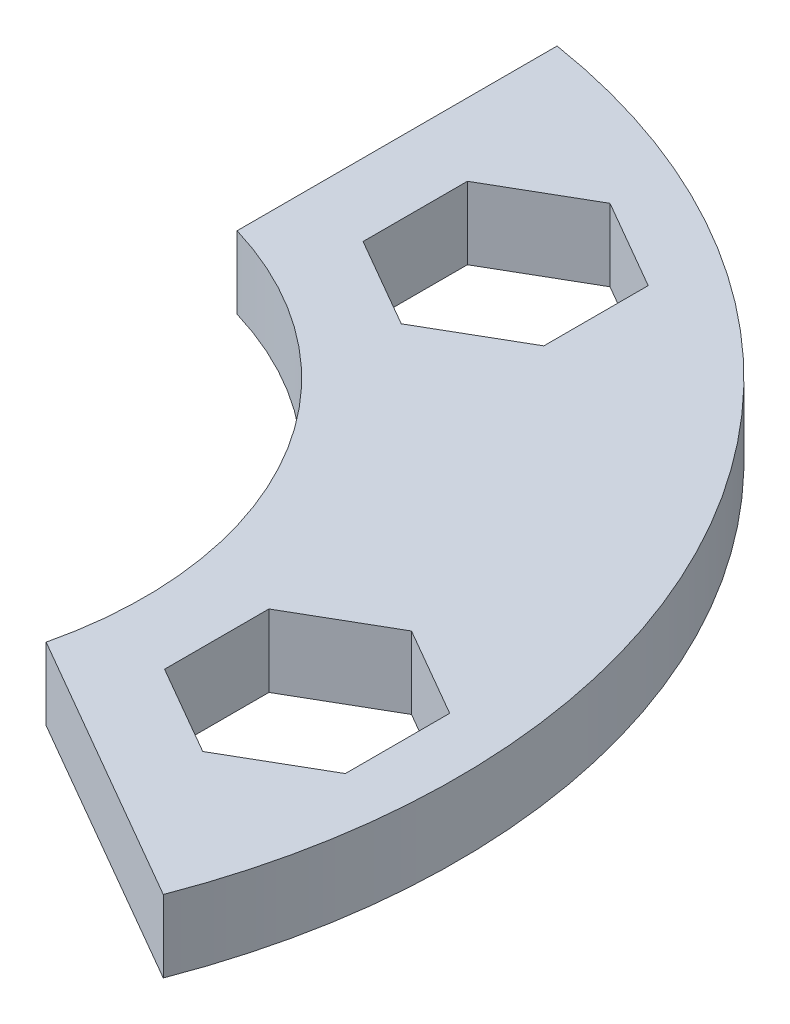
from build123d import *

# Parameters (mm, degrees)
SKETCH1_R           = 38.3
SKETCH1_R_2         = 21
BOSS_EXTRUDE1_DEPTH = 4
CUT_EXTRUDE1_DEPTH  = 10


with BuildPart() as part:
    # Sketch1 → Boss-Extrude1 (new body)
    with BuildSketch(Plane(origin=(0, 0, 0), x_dir=(1, 0, 0), z_dir=(0, 1, 0))):
        Circle(SKETCH1_R)
        Circle(SKETCH1_R_2, mode=Mode.SUBTRACT)
        Polygon((10, -28.867513459), (15, -31.754264805), (20, -28.867513459), (20, -23.094010768), (15, -20.207259422), (10, -23.094010768), align=None, mode=Mode.SUBTRACT)
        Polygon((30, 5.773502692), (25, 2.886751346), (25, -2.886751346), (30, -5.773502692), (35, -2.886751346), (35, 2.886751346), align=None, mode=Mode.SUBTRACT)
        Polygon((-20, -23.094010768), (-20, -28.867513459), (-15, -31.754264805), (-10, -28.867513459), (-10, -23.094010768), (-15, -20.207259422), align=None, mode=Mode.SUBTRACT)
        Polygon((-30, 5.773502692), (-35, 2.886751346), (-35, -2.886751346), (-30, -5.773502692), (-25, -2.886751346), (-25, 2.886751346), align=None, mode=Mode.SUBTRACT)
        Polygon((-10, 28.867513459), (-15, 31.754264805), (-20, 28.867513459), (-20, 23.094010768), (-15, 20.207259422), (-10, 23.094010768), align=None, mode=Mode.SUBTRACT)
        Polygon((20, 23.094010768), (20, 28.867513459), (15, 31.754264805), (10, 28.867513459), (10, 23.094010768), (15, 20.207259422), align=None, mode=Mode.SUBTRACT)
    extrude(amount=BOSS_EXTRUDE1_DEPTH)

    # Sketch2 → Cut-Extrude1 (cut)
    with BuildSketch(Plane(origin=(0, 4, 0), x_dir=(1, 0, 0), z_dir=(0, 1, 0))):
        with BuildLine():
            Line((6, 50.276302336), (6, 14.297506921))
            ThreePointArc((6, 14.297506921), (13.428105902, 7.752720557), (15.382004204, -1.952601038))
            Line((15.382004204, -1.952601038), (46.540555031, -19.941998745))
            ThreePointArc((46.540555031, -19.941998745), (-43.84951462, -25.31652907), (6, 50.276302336))
        make_face()
    extrude(amount=-CUT_EXTRUDE1_DEPTH, mode=Mode.SUBTRACT)


solid = part.part
